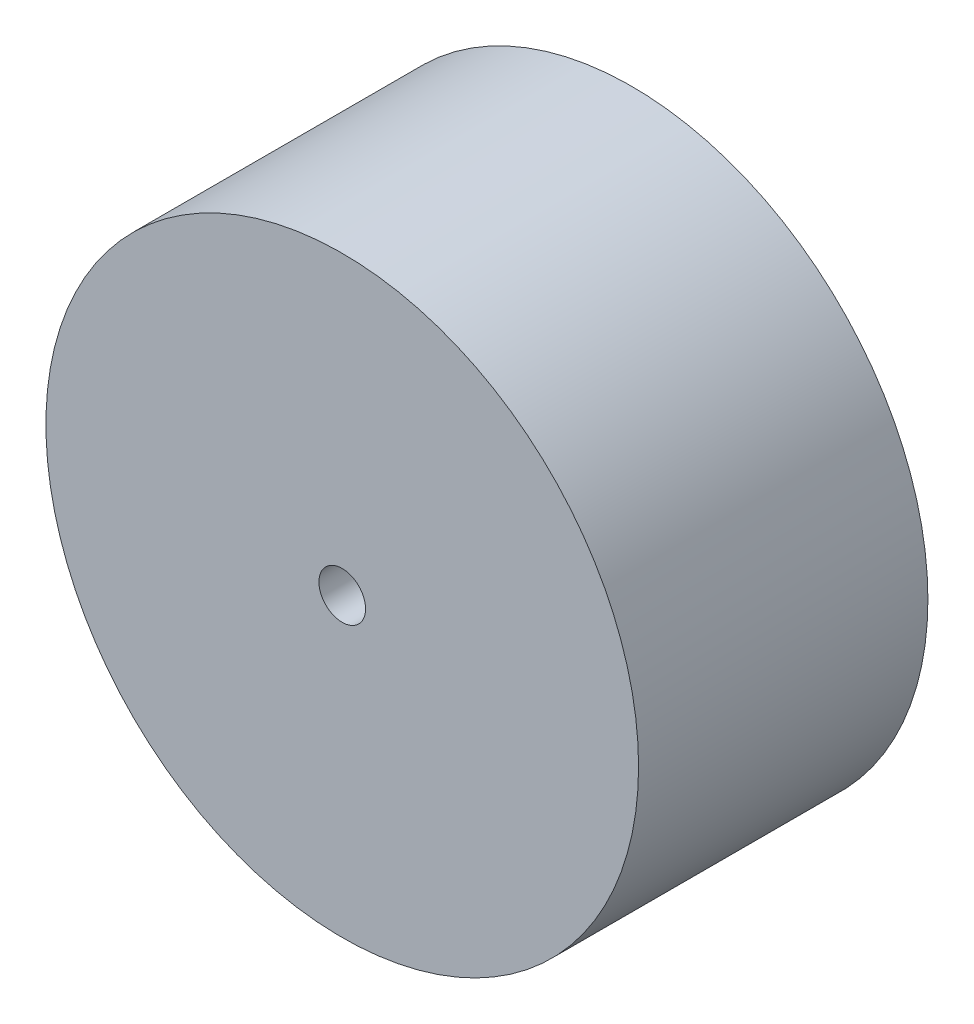
from build123d import *

# Parameters (mm, degrees)
SKETCH1_R           = 63.5
BOSS_EXTRUDE1_DEPTH = 62
SKETCH2_R           = 5
CUT_EXTRUDE1_DEPTH  = 110.126073878


with BuildPart() as part:
    # Sketch1 → Boss-Extrude1 (new body)
    with BuildSketch(Plane.XY):
        Circle(SKETCH1_R)
    extrude(amount=BOSS_EXTRUDE1_DEPTH)

    # Sketch2 → Cut-Extrude1 (cut, through all)
    with BuildSketch(Plane(origin=(0, 0, 0), x_dir=(-1, 0, 0), z_dir=(0, 0, -1))):
        Circle(SKETCH2_R)
    extrude(amount=-CUT_EXTRUDE1_DEPTH, mode=Mode.SUBTRACT)


solid = part.part
